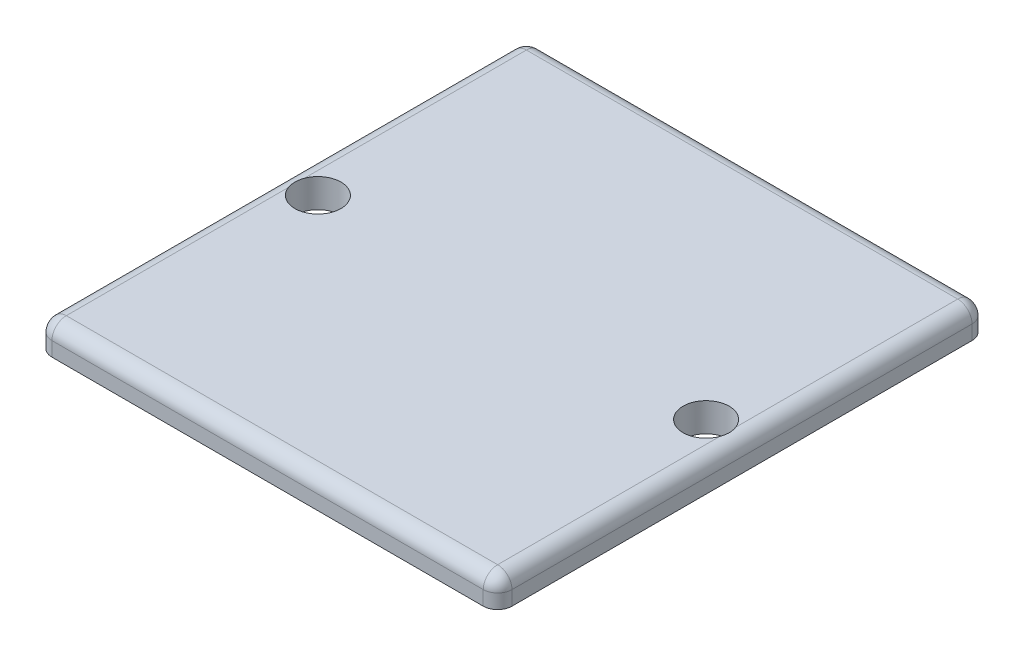
from build123d import *

# Parameters (mm, degrees)
SKETCH2_W           = 32
SKETCH2_H           = 34
SKETCH2_R           = 1.6
BOSS_EXTRUDE1_DEPTH = 2
FILLET1_R           = 1


with BuildPart() as part:
    # Sketch2 → Boss-Extrude1 (new body)
    with BuildSketch(Plane(origin=(0, 0, 0), x_dir=(1, 0, 0), z_dir=(0, 1, 0))):
        Rectangle(SKETCH2_W, SKETCH2_H)
        with Locations(Location((-13.5, 0, 0), (0, 0, 270))):
            Circle(SKETCH2_R, mode=Mode.SUBTRACT)
        with Locations(Location((13.5, 0, 0), (0, 0, 90))):
            Circle(SKETCH2_R, mode=Mode.SUBTRACT)
    extrude(amount=BOSS_EXTRUDE1_DEPTH)

    # Fillet1
    # the kernel refuses this fillet: 1 mm, written as the material it takes off along each edge
    with BuildSketch(Plane(origin=(-15, 1, -16), x_dir=(-1, 0, 0), z_dir=(0, 0, -1))) as fillet1_piece_1_section:
        Polygon((0, 0), (FILLET1_R, 0), (FILLET1_R, FILLET1_R), (0, FILLET1_R), align=None)
    fillet1_piece_1 = extrude(amount=FILLET1_R, mode=Mode.PRIVATE)
    fillet1_piece_1 = fillet1_piece_1 - Plane(origin=(-15, 1, -16), x_dir=(0.7071067811865475, -0.7071067811865475, 0), z_dir=(0, 0, -1)) * Sphere(FILLET1_R, mode=Mode.PRIVATE)
    add(fillet1_piece_1, mode=Mode.SUBTRACT)
    with BuildSketch(Plane(origin=(-15, 1, 16), x_dir=(-1, 0, 0), z_dir=(0, 0, 1))) as fillet1_piece_2_section:
        Polygon((0, 0), (FILLET1_R, 0), (FILLET1_R, -FILLET1_R), (0, -FILLET1_R), align=None)
    fillet1_piece_2 = extrude(amount=FILLET1_R, mode=Mode.PRIVATE)
    fillet1_piece_2 = fillet1_piece_2 - Plane(origin=(-15, 1, 16), x_dir=(0.7071067811865475, -0.7071067811865475, 0), z_dir=(0, 0, 1)) * Sphere(FILLET1_R, mode=Mode.PRIVATE)
    add(fillet1_piece_2, mode=Mode.SUBTRACT)
    with BuildSketch(Plane(origin=(15, 1, 16), x_dir=(1, 0, 0), z_dir=(0, 0, 1))) as fillet1_piece_3_section:
        Polygon((0, 0), (FILLET1_R, 0), (FILLET1_R, FILLET1_R), (0, FILLET1_R), align=None)
    fillet1_piece_3 = extrude(amount=FILLET1_R, mode=Mode.PRIVATE)
    fillet1_piece_3 = fillet1_piece_3 - Plane(origin=(15, 1, 16), x_dir=(-0.7071067811865475, -0.7071067811865475, 0), z_dir=(0, 0, 1)) * Sphere(FILLET1_R, mode=Mode.PRIVATE)
    add(fillet1_piece_3, mode=Mode.SUBTRACT)
    with BuildSketch(Plane(origin=(15, 1, -16), x_dir=(0, 0, -1), z_dir=(1, 0, 0))) as fillet1_piece_4_section:
        Polygon((0, 0), (FILLET1_R, 0), (FILLET1_R, FILLET1_R), (0, FILLET1_R), align=None)
    fillet1_piece_4 = extrude(amount=FILLET1_R, mode=Mode.PRIVATE)
    fillet1_piece_4 = fillet1_piece_4 - Plane(origin=(15, 1, -16), x_dir=(0, -0.7071067811865475, 0.7071067811865475), z_dir=(1, 0, 0)) * Sphere(FILLET1_R, mode=Mode.PRIVATE)
    add(fillet1_piece_4, mode=Mode.SUBTRACT)
    with BuildSketch(Plane(origin=(-16, 2, -16), x_dir=(0, -1, 0), z_dir=(0, 0, 1)), Plane(origin=(16, 2, 16), x_dir=(0, -1, 0), z_dir=(0, 0, -1))) as fillet1_piece_5:
        with BuildLine():
            CenterArc((FILLET1_R, FILLET1_R), FILLET1_R, 180, 90)
            Line((0, FILLET1_R), (0, 0))
            Line((0, 0), (FILLET1_R, 0))
        make_face()
    extrude(amount=32, mode=Mode.SUBTRACT)
    with BuildSketch(Plane(origin=(-15, 2, 17), x_dir=(0, -1, 0), z_dir=(1, 0, 0)), Plane(origin=(15, 2, -17), x_dir=(0, -1, 0), z_dir=(-1, 0, 0))) as fillet1_piece_6:
        with BuildLine():
            CenterArc((FILLET1_R, FILLET1_R), FILLET1_R, 180, 90)
            Line((0, FILLET1_R), (0, 0))
            Line((0, 0), (FILLET1_R, 0))
        make_face()
    extrude(amount=30, mode=Mode.SUBTRACT)
    with BuildSketch(Plane(origin=(16, -2.5, 17), x_dir=(-1, 0, 0), z_dir=(0, 1, 0)), Plane(origin=(-16, -2.5, -17), x_dir=(1, 0, 0), z_dir=(0, 1, 0)), Plane(origin=(16, -2.5, -17), x_dir=(0, 0, 1), z_dir=(0, 1, 0))) as fillet1_piece_7:
        with BuildLine():
            CenterArc((FILLET1_R, -FILLET1_R), FILLET1_R, 90, 90)
            Line((0, -FILLET1_R), (0, 0))
            Line((0, 0), (FILLET1_R, 0))
        make_face()
    extrude(amount=3.5, mode=Mode.SUBTRACT)
    with BuildSketch(Plane(origin=(-16, -2.5, 17), x_dir=(1, 0, 0), z_dir=(0, 1, 0))) as fillet1_piece_8:
        with BuildLine():
            CenterArc((FILLET1_R, FILLET1_R), FILLET1_R, 180, 90)
            Line((0, FILLET1_R), (0, 0))
            Line((0, 0), (FILLET1_R, 0))
        make_face()
    extrude(amount=3.5, mode=Mode.SUBTRACT)


solid = part.part
